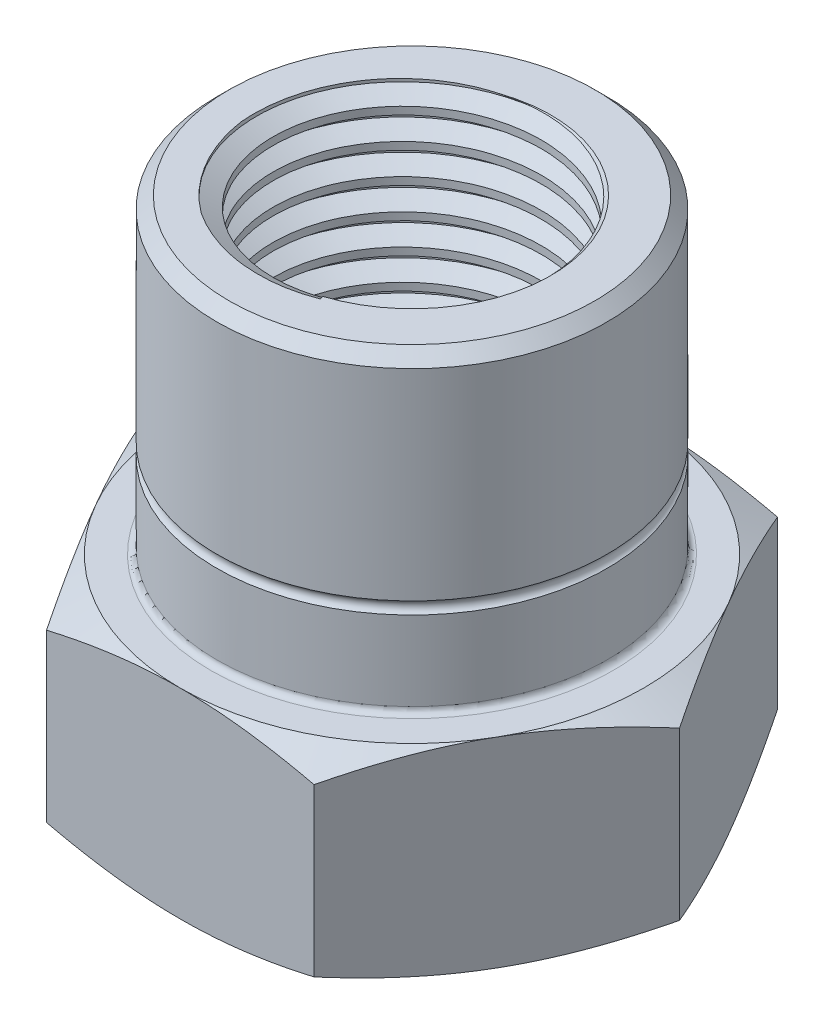
from build123d import *

# Parameters (mm, degrees)
BOSS_EXTRUDE1_DEPTH   = 8.2
SKETCH2_OUTSIDE_W     = 34.26
SKETCH2_OUTSIDE_H     = 31.32
SKETCH2_OUTSIDE_R     = 9.5
CUT_EXTRUDE1_DEPTH    = 1
CUT_EXTRUDE1_DRAFT    = -65
SKETCH3_OUTSIDE_W     = 34.26
SKETCH3_OUTSIDE_H     = 31.32
SKETCH3_OUTSIDE_R     = 9.5
CUT_EXTRUDE2_DEPTH    = 1
CUT_EXTRUDE2_DRAFT    = -65
SKETCH4_R             = 8
BOSS_EXTRUDE2_DEPTH   = 12.75
CHAMFER1_SIZE         = 0.5
FILLET1_R             = 0.25
M10_CLEARANCE_HOLE1_D = 11
CHAMFER2_SIZE         = 1
CHAMFER3_SIZE         = 0.2
THREAD1_PITCH         = 1.25


with BuildPart() as part:
    # Sketch1 → Boss-Extrude1 (new body)
    with BuildSketch(Plane(origin=(0, 0, 0), x_dir=(1, 0, 0), z_dir=(0, 1, 0))):
        Polygon((10.969655115, 0), (5.484827557, 9.5), (-5.484827557, 9.5), (-10.969655115, 0), (-5.484827557, -9.5), (5.484827557, -9.5), align=None)
    extrude(amount=BOSS_EXTRUDE1_DEPTH)


with BuildPart() as cut_extrude1_tool:
    # Sketch2 outside → Cut-Extrude1 (with draft: the straight prism first)
    with BuildSketch(Plane.XZ):
        Rectangle(SKETCH2_OUTSIDE_W, SKETCH2_OUTSIDE_H)
        Circle(SKETCH2_OUTSIDE_R, mode=Mode.SUBTRACT)
    extrude(amount=-CUT_EXTRUDE1_DEPTH)
    # Cut-Extrude1: the draft: its side faces are tilted about the plane it starts from
    cut_extrude1_sides = [cut_extrude1_tool.faces().sort_by_distance(p)[0] for p in [
        (0, 0.5, -15.66),
        (17.13, 0.5, 0),
        (0, 0.5, 15.66),
        (-17.13, 0.5, 0),
        (-9.5, 0.5, 0),
    ]]
    draft(cut_extrude1_sides, Plane.XZ, CUT_EXTRUDE1_DRAFT)


with BuildPart() as part_1:
    add(part.part)

    # Cut-Extrude1: cut by cut_extrude1_tool
    add(cut_extrude1_tool.part, mode=Mode.SUBTRACT)


with BuildPart() as cut_extrude2_tool:
    # Sketch3 outside → Cut-Extrude2 (with draft: the straight prism first)
    with BuildSketch(Plane(origin=(0, 8.2, 0), x_dir=(1, 0, 0), z_dir=(0, 1, 0))):
        Rectangle(SKETCH3_OUTSIDE_W, SKETCH3_OUTSIDE_H)
        Circle(SKETCH3_OUTSIDE_R, mode=Mode.SUBTRACT)
    extrude(amount=-CUT_EXTRUDE2_DEPTH)
    # Cut-Extrude2: the draft: its side faces are tilted about the plane it starts from
    cut_extrude2_sides = [cut_extrude2_tool.faces().sort_by_distance(p)[0] for p in [
        (0, 7.7, 15.66),
        (17.13, 7.7, 0),
        (0, 7.7, -15.66),
        (-17.13, 7.7, 0),
        (-9.5, 7.7, 0),
    ]]
    draft(cut_extrude2_sides, Plane(origin=(0, 8.2, 0), x_dir=(1, 0, 0), z_dir=(0, 1, 0)), CUT_EXTRUDE2_DRAFT)


with BuildPart() as part_2:
    add(part_1.part)

    # Cut-Extrude2: cut by cut_extrude2_tool
    add(cut_extrude2_tool.part, mode=Mode.SUBTRACT)

    # Sketch4 → Boss-Extrude2 (add)
    with BuildSketch(Plane(origin=(0, 8.2, 0), x_dir=(1, 0, 0), z_dir=(0, 1, 0))):
        with Locations(Location((0, 0, 0), (0, 0, 270))):
            Circle(SKETCH4_R)
    extrude(amount=BOSS_EXTRUDE2_DEPTH)

    # Chamfer1
    chamfer1_edges = [part_2.edges().sort_by_distance(p)[0] for p in [
        (0, 20.95, -8),
    ]]
    chamfer(chamfer1_edges, length=CHAMFER1_SIZE)

    # Fillet1
    fillet1_edges = [part_2.edges().sort_by_distance(p)[0] for p in [
        (0, 8.2, -8),
    ]]
    fillet(fillet1_edges, radius=FILLET1_R)

    # M10 Clearance Hole1 (through all)
    with Locations(Plane(origin=(0, 0, 0), x_dir=(-1, 0, 0), z_dir=(0, -1, 0))):
        with Locations((0, 0)):
            Hole(M10_CLEARANCE_HOLE1_D / 2)

    # Chamfer2
    chamfer2_edges = [part_2.edges().sort_by_distance(p)[0] for p in [
        (-5.5, 0, 0),
    ]]
    chamfer(chamfer2_edges, length=CHAMFER2_SIZE)

    # Chamfer3
    chamfer3_edges = [part_2.edges().sort_by_distance(p)[0] for p in [
        (-5.5, 20.95, 0),
    ]]
    chamfer(chamfer3_edges, length=CHAMFER3_SIZE)

    # Thread1: the profile of Thread Profile1 profile screwed along a right-hand helix of 15.8 turns, 8 arcs to a turn; built about Z, then put on its axis
    thread1_z = Axis((0, 0, 0), (0, 0, 1))
    thread1_corners = [(5.4997, 0, -0.000173205), (6.176582344, 0, 0.390624998), (6.176582344, 0, 0.546874998), (5.4997, 0, 0.937673202)]
    with BuildLine(mode=Mode.PRIVATE) as thread1_profile:
        Line(thread1_corners[0], thread1_corners[1])
        Line(thread1_corners[1], thread1_corners[2])
        Line(thread1_corners[2], thread1_corners[3])
        Line(thread1_corners[3], thread1_corners[0])
    thread1_cap = Face(thread1_profile.wire())
    thread1_turn_angles = [0, 22.5, 45, 67.5, 90, 112.5, 135, 157.5, 180, 202.5, 225, 247.5, 270, 292.5, 315, 337.5, 360]
    thread1_turn_weights = [1, 0.9238795325112867, 1, 0.9238795325112867, 1, 0.9238795325112867, 1, 0.9238795325112867, 1, 0.9238795325112867, 1, 0.9238795325112867, 1, 0.9238795325112867, 1, 0.9238795325112867, 1]
    thread1_turn_rails = [Edge.make_bspline([Vector(p[0], p[1], 0).rotate(thread1_z, thread1_turn_angles[k]) / thread1_turn_weights[k] + Vector(0, 0, p[2] + THREAD1_PITCH * thread1_turn_angles[k] / 360) for k in range(17)], [0, 0, 0, 1, 1, 2, 2, 3, 3, 4, 4, 5, 5, 6, 6, 7, 7, 8, 8, 8], 2, thread1_turn_weights) for p in thread1_corners]
    thread1_turn_sides = [Face.make_surface_from_curves(thread1_turn_rails[p[0]], thread1_turn_rails[p[1]]) for p in [(0, 1), (1, 2), (2, 3), (3, 0)]]
    thread1_last_angles = [5400, 5422.5, 5445, 5467.5, 5490, 5512.5, 5535, 5557.5, 5580, 5602.5, 5625, 5647.5, 5670, 5679, 5688]
    thread1_last_weights = [1, 0.9238795325112867, 1, 0.9238795325112867, 1, 0.9238795325112867, 1, 0.9238795325112867, 1, 0.9238795325112867, 1, 0.9238795325112867, 1, 0.987688340595139, 1]
    thread1_last_rails = [Edge.make_bspline([Vector(p[0], p[1], 0).rotate(thread1_z, thread1_last_angles[k]) / thread1_last_weights[k] + Vector(0, 0, p[2] + THREAD1_PITCH * thread1_last_angles[k] / 360) for k in range(15)], [0, 0, 0, 1, 1, 2, 2, 3, 3, 4, 4, 5, 5, 6, 6, 7, 7, 7], 2, thread1_last_weights) for p in thread1_corners]
    thread1_last_sides = [Face.make_surface_from_curves(thread1_last_rails[p[0]], thread1_last_rails[p[1]]) for p in [(0, 1), (1, 2), (2, 3), (3, 0)]]
    thread1 = Plane(origin=(0, 1, 0), x_dir=(1, 0, 0), z_dir=(0, 1, 0)) * Solid(Shell([*[p.moved(Location((0, 0, THREAD1_PITCH * i))) for i in range(15) for p in thread1_turn_sides], *thread1_last_sides, thread1_cap, thread1_cap.rotate(thread1_z, 5688).moved(Location((0, 0, THREAD1_PITCH * 5688 / 360)))]))
    add(thread1, mode=Mode.SUBTRACT)

    # Sketch11 → Cut-Revolve1 (revolve, cut)
    with BuildSketch(Plane.XY):
        with BuildLine():
            Line((-8, 12.2), (-8, 11.7))
            ThreePointArc((-8, 11.7), (-7.85, 11.95), (-8, 12.2))
        make_face()
    revolve(axis=Axis((0, 0, 0), (0, -1, 0)), mode=Mode.SUBTRACT)


solid = part_2.part
